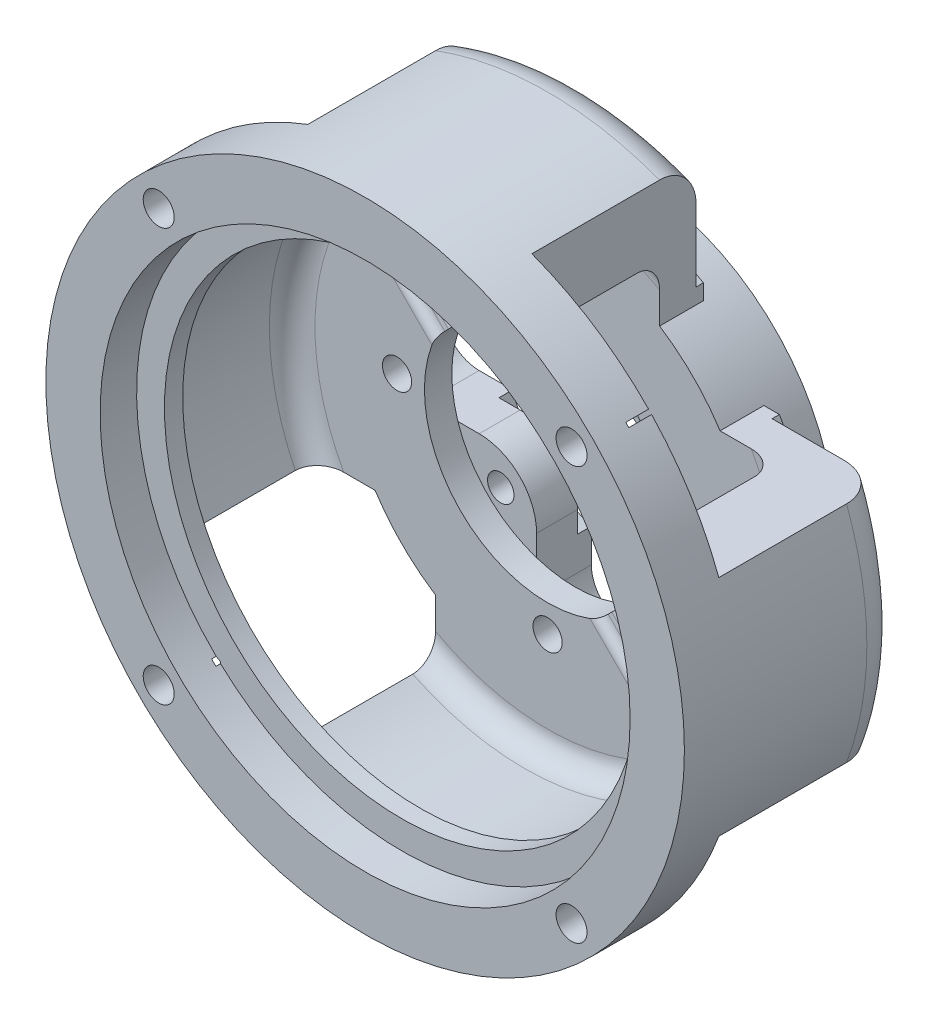
from build123d import *

# Parameters (mm, degrees)
SKETCH_1_W                    = 35
SKETCH_1_H                    = 6
CUT_EXTRUDE_1_DEPTH           = 2.5
HOLE_WIZARD_M48_1_D           = 52
HOLE_WIZARD_M48_1_CBORE_D     = 58.1
HOLE_WIZARD_M48_1_CBORE_DEPTH = 4
CUT_EXTRUDE_2_DEPTH           = 50.859803449
CUT_EXTRUDE_2_DEPTH_BACK      = 50.859803449
SKETCH_17_R                   = 1.7
EXTRUDE_START                 = 23
SKETCH_18_R                   = 35
EXTRUDE_1_DEPTH               = 23
SKETCH_19_R                   = 28
CUT_EXTRUDE_3_DEPTH           = 14
SKETCH_20_R                   = 13.5
CUT_EXTRUDE_5_DEPTH           = 23
CUT_EXTRUDE_6_DEPTH           = 6
SKETCH_22_R                   = 1.6
CUT_EXTRUDE_7_DEPTH           = 3
EXTRUDE_START_2               = 4.5
SKETCH_24_R                   = 1.45
EXTRUDE_2_DEPTH               = 4.5
SKETCH_25_R                   = 35
SKETCH_25_R_2                 = 24
CUT_EXTRUDE_8_DEPTH           = 5
SKETCH_27_R                   = 24
SKETCH_27_R_2                 = 22.55
CUT_EXTRUDE_9_DEPTH           = 4.2
CUT_EXTRUDE_10_DEPTH          = 1.5
FILLET_1_R                    = 4
FILLET_2_R                    = 2.5
CUT_EXTRUDE_11_DEPTH          = 73.526395572
CUT_EXTRUDE_11_DEPTH_BACK     = 73.526395572
SKETCH_31_W                   = 9.376817256
SKETCH_31_H                   = 2.4
FILLET_3_R                    = 1


with BuildPart() as part:
    # 草图1 → 旋转1 (revolve)
    with BuildSketch(Plane(origin=(0, 0, 0), x_dir=(1, 0, 0), z_dir=(0, 1, 0))):
        with Locations((17.5, 27.010169219)):
            Rectangle(SKETCH_1_W, SKETCH_1_H)
    revolve(axis=Axis((0, 0, -30.010169219), (0, 0, 1)))

    # 草图2 → 切除-拉伸1 (cut)
    with BuildSketch(Plane(origin=(0, 0, -30.010169219), x_dir=(-1, 0, 0), z_dir=(0, 0, -1))):
        Polygon((-21.025270001, -19.852416998), (-24.229563995, -19.852416998), (-25.831710992, -22.627416998), (-24.229563995, -25.402416998), (-21.025270001, -25.402416998), (-19.423123004, -22.627416998), align=None)
        Polygon((-22.627416998, 25.831710992), (-25.402416998, 24.229563995), (-25.402416998, 21.025270001), (-22.627416998, 19.423123004), (-19.852416998, 21.025270001), (-19.852416998, 24.229563995), align=None)
        Polygon((25.831710992, 22.627416998), (24.229563995, 25.402416998), (21.025270001, 25.402416998), (19.423123004, 22.627416998), (21.025270001, 19.852416998), (24.229563995, 19.852416998), align=None)
        Polygon((22.627416998, -25.831710992), (25.402416998, -24.229563995), (25.402416998, -21.025270001), (22.627416998, -19.423123004), (19.852416998, -21.025270001), (19.852416998, -24.229563995), align=None)
    extrude(amount=-CUT_EXTRUDE_1_DEPTH, mode=Mode.SUBTRACT)

    # M48 六角头螺栓的柱形沉头孔1 (through all)
    with Locations(Plane.XY.offset(-24.010169219)):
        with Locations((0, 0)):
            CounterBoreHole(HOLE_WIZARD_M48_1_D / 2, HOLE_WIZARD_M48_1_CBORE_D / 2, HOLE_WIZARD_M48_1_CBORE_DEPTH)

    # 草图17 → 切除-拉伸2 (cut, two sides: drawn at the far end of the back side and taken through both)
    with BuildSketch(Plane(origin=(0, 0, -30.010169219), x_dir=(-1, 0, 0), z_dir=(0, 0, -1)).offset(-CUT_EXTRUDE_2_DEPTH_BACK)):
        with Locations((-22.627416998, -22.627416998)):
            Circle(SKETCH_17_R)
        with Locations((-22.627416998, 22.627416998)):
            Circle(SKETCH_17_R)
        with Locations((22.627416998, 22.627416998)):
            Circle(SKETCH_17_R)
        with Locations((22.627416998, -22.627416998)):
            Circle(SKETCH_17_R)
    extrude(amount=CUT_EXTRUDE_2_DEPTH + CUT_EXTRUDE_2_DEPTH_BACK, mode=Mode.SUBTRACT)

    # 草图18 → 凸台-拉伸1 (add)
    with BuildSketch(Plane(origin=(0, 0, -30.010169219), x_dir=(-1, 0, 0), z_dir=(0, 0, -1)).offset(EXTRUDE_START)):
        with Locations(Location((0, 0, 0), (0, 0, 180))):
            Circle(SKETCH_18_R)
    extrude(amount=-EXTRUDE_1_DEPTH)

    # 草图19 → 切除-拉伸3 (cut)
    with BuildSketch(Plane.XY.offset(-30.010169219)):
        Circle(SKETCH_19_R)
    extrude(amount=-CUT_EXTRUDE_3_DEPTH, mode=Mode.SUBTRACT)

    # 草图20 → 切除-拉伸5 (cut)
    with BuildSketch(Plane(origin=(0, 0, -53.010169219), x_dir=(-1, 0, 0), z_dir=(0, 0, -1))):
        with BuildLine():
            ThreePointArc((-12.28161024, -18.912021307), (-15.945257916, -15.945257916), (-18.912021307, -12.28161024))
            Line((-18.912021307, -12.28161024), (-32.774411511, -12.28161024))
            ThreePointArc((-32.774411511, -12.28161024), (-24.748737342, -24.748737342), (-12.28161024, -32.774411511))
            Line((-12.28161024, -32.774411511), (-12.28161024, -18.912021307))
        make_face()
        with BuildLine():
            ThreePointArc((-12.28161024, 32.774411511), (-24.748737342, 24.748737342), (-32.774411511, 12.28161024))
            Line((-32.774411511, 12.28161024), (-18.912021307, 12.28161024))
            ThreePointArc((-18.912021307, 12.28161024), (-15.945257916, 15.945257916), (-12.28161024, 18.912021307))
            Line((-12.28161024, 18.912021307), (-12.28161024, 32.774411511))
        make_face()
        with BuildLine():
            Line((12.28161024, -18.912021307), (12.28161024, -32.774411511))
            ThreePointArc((12.28161024, -32.774411511), (24.748737342, -24.748737342), (32.774411511, -12.28161024))
            Line((32.774411511, -12.28161024), (18.912021307, -12.28161024))
            ThreePointArc((18.912021307, -12.28161024), (15.945257916, -15.945257916), (12.28161024, -18.912021307))
        make_face()
        with BuildLine():
            ThreePointArc((32.774411511, 12.28161024), (24.748737342, 24.748737342), (12.28161024, 32.774411511))
            Line((12.28161024, 32.774411511), (12.28161024, 18.912021307))
            ThreePointArc((12.28161024, 18.912021307), (15.945257916, 15.945257916), (18.912021307, 12.28161024))
            Line((18.912021307, 12.28161024), (32.774411511, 12.28161024))
        make_face()
        Circle(SKETCH_20_R)
    extrude(amount=-CUT_EXTRUDE_5_DEPTH, mode=Mode.SUBTRACT)

    # 草图21 → 切除-拉伸6 (cut)
    with BuildSketch(Plane(origin=(0, 0, -53.010169219), x_dir=(-1, 0, 0), z_dir=(0, 0, -1))):
        with BuildLine():
            Line((-4.2, 16.5), (-4.2, 10.5))
            ThreePointArc((-4.2, 10.5), (-6.045227279, 6.045227279), (-10.5, 4.2))
            Line((-10.5, 4.2), (-16.5, 4.2))
            ThreePointArc((-16.5, 4.2), (-19.328427125, 3.028427125), (-20.5, 0.2))
            Line((-20.5, 0.2), (-20.5, -0.2))
            ThreePointArc((-20.5, -0.2), (-19.328427125, -3.028427125), (-16.5, -4.2))
            Line((-16.5, -4.2), (-10.5, -4.2))
            ThreePointArc((-10.5, -4.2), (-6.045227279, -6.045227279), (-4.2, -10.5))
            Line((-4.2, -10.5), (-4.2, -16.5))
            ThreePointArc((-4.2, -16.5), (-3.028427125, -19.328427125), (-0.2, -20.5))
            Line((-0.2, -20.5), (0.2, -20.5))
            ThreePointArc((0.2, -20.5), (3.028427125, -19.328427125), (4.2, -16.5))
            Line((4.2, -16.5), (4.2, -10.5))
            ThreePointArc((4.2, -10.5), (6.045227279, -6.045227279), (10.5, -4.2))
            Line((10.5, -4.2), (16.5, -4.2))
            ThreePointArc((16.5, -4.2), (19.328427125, -3.028427125), (20.5, -0.2))
            Line((20.5, -0.2), (20.5, 0.2))
            ThreePointArc((20.5, 0.2), (19.328427125, 3.028427125), (16.5, 4.2))
            Line((16.5, 4.2), (10.5, 4.2))
            ThreePointArc((10.5, 4.2), (6.045227279, 6.045227279), (4.2, 10.5))
            Line((4.2, 10.5), (4.2, 16.5))
            ThreePointArc((4.2, 16.5), (3.028427125, 19.328427125), (0.2, 20.5))
            Line((0.2, 20.5), (-0.2, 20.5))
            ThreePointArc((-0.2, 20.5), (-3.028427125, 19.328427125), (-4.2, 16.5))
        make_face()
    extrude(amount=-CUT_EXTRUDE_6_DEPTH, mode=Mode.SUBTRACT)

    # 草图22 → 切除-拉伸7 (cut)
    with BuildSketch(Plane(origin=(0, 0, -47.010169219), x_dir=(-1, 0, 0), z_dir=(0, 0, -1))):
        with Locations((-16.5, 0)):
            Circle(SKETCH_22_R)
        with Locations((0, 16.5)):
            Circle(SKETCH_22_R)
        with Locations((16.5, 0)):
            Circle(SKETCH_22_R)
        with Locations((0, -16.5)):
            Circle(SKETCH_22_R)
    extrude(amount=-CUT_EXTRUDE_7_DEPTH, mode=Mode.SUBTRACT)

    # 草图24 → 凸台-拉伸2 (add)
    # profile 1 of 4: a face of its own
    with BuildSketch(Plane(origin=(0, 0, -47.010169219), x_dir=(-1, 0, 0), z_dir=(0, 0, -1)).offset(EXTRUDE_START_2)):
        with BuildLine():
            Line((-10.5, -4.2), (-12.830042868, -4.2))
            ThreePointArc((-12.830042868, -4.2), (-9.545941546, -9.545941546), (-4.2, -12.830042868))
            Line((-4.2, -12.830042868), (-4.2, -10.5))
            ThreePointArc((-4.2, -10.5), (-6.045227279, -6.045227279), (-10.5, -4.2))
        make_face()
        with Locations((-8.131727984, -8.131727984)):
            Circle(SKETCH_24_R, mode=Mode.SUBTRACT)
    # profile 2 of 4: a face of its own
    with BuildSketch(Plane(origin=(0, 0, -47.010169219), x_dir=(-1, 0, 0), z_dir=(0, 0, -1)).offset(EXTRUDE_START_2)):
        with BuildLine():
            ThreePointArc((-4.2, 12.830042868), (-9.545941546, 9.545941546), (-12.830042868, 4.2))
            Line((-12.830042868, 4.2), (-10.5, 4.2))
            ThreePointArc((-10.5, 4.2), (-6.045227279, 6.045227279), (-4.2, 10.5))
            Line((-4.2, 10.5), (-4.2, 12.830042868))
        make_face()
        with Locations((-8.131727984, 8.131727984)):
            Circle(SKETCH_24_R, mode=Mode.SUBTRACT)
    # profile 3 of 4: a face of its own
    with BuildSketch(Plane(origin=(0, 0, -47.010169219), x_dir=(-1, 0, 0), z_dir=(0, 0, -1)).offset(EXTRUDE_START_2)):
        with BuildLine():
            Line((4.2, -10.5), (4.2, -12.830042868))
            ThreePointArc((4.2, -12.830042868), (9.545941546, -9.545941546), (12.830042868, -4.2))
            Line((12.830042868, -4.2), (10.5, -4.2))
            ThreePointArc((10.5, -4.2), (6.045227279, -6.045227279), (4.2, -10.5))
        make_face()
        with Locations((8.131727984, -8.131727984)):
            Circle(SKETCH_24_R, mode=Mode.SUBTRACT)
    # profile 4 of 4: a face of its own
    with BuildSketch(Plane(origin=(0, 0, -47.010169219), x_dir=(-1, 0, 0), z_dir=(0, 0, -1)).offset(EXTRUDE_START_2)):
        with BuildLine():
            ThreePointArc((12.830042868, 4.2), (9.545941546, 9.545941546), (4.2, 12.830042868))
            Line((4.2, 12.830042868), (4.2, 10.5))
            ThreePointArc((4.2, 10.5), (6.045227279, 6.045227279), (10.5, 4.2))
            Line((10.5, 4.2), (12.830042868, 4.2))
        make_face()
        with Locations((8.131727984, 8.131727984)):
            Circle(SKETCH_24_R, mode=Mode.SUBTRACT)
    extrude(amount=-EXTRUDE_2_DEPTH)

    # 草图25 → 切除-拉伸8 (cut)
    with BuildSketch(Plane(origin=(0, 0, -53.010169219), x_dir=(-1, 0, 0), z_dir=(0, 0, -1))):
        with Locations(Location((0, 0, 0), (0, 0, 180))):
            Circle(SKETCH_25_R)
        Circle(SKETCH_25_R_2, mode=Mode.SUBTRACT)
    extrude(amount=-CUT_EXTRUDE_8_DEPTH, mode=Mode.SUBTRACT)

    # 草图27 → 切除-拉伸9 (cut)
    with BuildSketch(Plane(origin=(0, 0, -53.010169219), x_dir=(-1, 0, 0), z_dir=(0, 0, -1))):
        Circle(SKETCH_27_R)
        Circle(SKETCH_27_R_2, mode=Mode.SUBTRACT)
    extrude(amount=-CUT_EXTRUDE_9_DEPTH, mode=Mode.SUBTRACT)

    # 草图29 → 切除-拉伸10 (cut)
    with BuildSketch(Plane(origin=(0, 0, -53.010169219), x_dir=(-1, 0, 0), z_dir=(0, 0, -1))):
        with BuildLine():
            Line((-9.5, 11.5), (9.5, 11.5))
            ThreePointArc((9.5, 11.5), (10.914213562, 10.914213562), (11.5, 9.5))
            Line((11.5, 9.5), (11.5, -9.5))
            ThreePointArc((11.5, -9.5), (10.914213562, -10.914213562), (9.5, -11.5))
            Line((9.5, -11.5), (-9.5, -11.5))
            ThreePointArc((-9.5, -11.5), (-10.914213562, -10.914213562), (-11.5, -9.5))
            Line((-11.5, -9.5), (-11.5, 9.5))
            ThreePointArc((-11.5, 9.5), (-10.914213562, 10.914213562), (-9.5, 11.5))
        make_face()
    extrude(amount=-CUT_EXTRUDE_10_DEPTH, mode=Mode.SUBTRACT)

    # 圆角1
    fillet_1_edges = [part.edges().sort_by_distance(p)[0] for p in [
        (34.439108604, 6.240817138, -48.010169219),
        (0, 35, -48.010169219),
        (-35, 0, -48.010169219),
        (0, -35, -48.010169219),
    ]]
    fillet(fillet_1_edges, radius=FILLET_1_R)

    # 圆角2
    fillet_2_edges = [part.edges().sort_by_distance(p)[0] for p in [
        (0, 28, -44.010169219),
        (-28, 0, -44.010169219),
        (0, -28, -44.010169219),
        (28, 0, -44.010169219),
    ]]
    fillet(fillet_2_edges, radius=FILLET_2_R)

    # 草图31 → 切除-拉伸11 (cut, two sides: drawn at the far end of the back side and taken through both)
    with BuildSketch(Plane(origin=(0, 0, 0), x_dir=(-0.7071067811865476, -0.7071067811865476, 0), z_dir=(0.7071067811865476, -0.7071067811865476, 0)).offset(-CUT_EXTRUDE_11_DEPTH_BACK)):
        with Locations((0, 45.210169219)):
            Rectangle(SKETCH_31_W, SKETCH_31_H)
    extrude(amount=CUT_EXTRUDE_11_DEPTH + CUT_EXTRUDE_11_DEPTH_BACK, mode=Mode.SUBTRACT)

    # 圆角3
    # the kernel refuses this fillet: 1 mm, written as the material it adds along each edge
    with BuildSketch(Plane(origin=(20.67978826, -14.049377193, -46.410169219), x_dir=(-0.7071067811865476, -0.7071067811865476, 0), z_dir=(-0.7071067811865476, 0.7071067811865476, 0))) as fillet_3_piece_1_section:
        with BuildLine():
            CenterArc((FILLET_3_R, FILLET_3_R), FILLET_3_R, 180, 90)
            Line((0, FILLET_3_R), (0, 0))
            Line((0, 0), (FILLET_3_R, 0))
        make_face()
    fillet_3_piece_1 = extrude(amount=14.397495993, mode=Mode.PRIVATE)
    fillet_3_piece_1 = fillet_3_piece_1 & Plane(origin=(0, 0, -46.303313987), x_dir=(0.5446390350150296, -0.8386705679454224, 0), z_dir=(0, 0, -1)) * Cylinder(22.55, 33, mode=Mode.PRIVATE)
    fillet_3_piece_1 = split(fillet_3_piece_1, bisect_by=Plane(origin=(18.48720103, -12.28161024, -46.303313987), z_dir=(0, -1, 0)), keep=Keep.TOP, mode=Mode.PRIVATE)
    add(fillet_3_piece_1)
    with BuildSketch(Plane(origin=(20.67978826, -14.049377193, -46.410169219), x_dir=(-0.7071067811865476, -0.7071067811865476, 0), z_dir=(-0.7071067811865476, 0.7071067811865476, 0))) as fillet_3_piece_2_section:
        with BuildLine():
            CenterArc((FILLET_3_R, FILLET_3_R), FILLET_3_R, 180, 90)
            Line((0, FILLET_3_R), (0, 0))
            Line((0, 0), (FILLET_3_R, 0))
        make_face()
    fillet_3_piece_2 = extrude(amount=14.397495993, mode=Mode.PRIVATE)
    fillet_3_piece_2 = fillet_3_piece_2 & Plane(origin=(0, 0, -46.179741801), x_dir=(0.5446390350150296, -0.8386705679454224, 0), z_dir=(0, 0, -1)) * Cylinder(22.55, 33, mode=Mode.PRIVATE)
    fillet_3_piece_2 = split(fillet_3_piece_2, bisect_by=Plane(origin=(15.38355487, -12.28161024, -46.179741801), z_dir=(0, 1, 0)), keep=Keep.TOP, mode=Mode.PRIVATE)
    fillet_3_piece_2 = fillet_3_piece_2 - Plane(origin=(0, 0, -46.179741801), x_dir=(-1, 0, 0), z_dir=(0, 0, -1)) * Cylinder(13.5, 33, mode=Mode.PRIVATE)
    add(fillet_3_piece_2)
    with BuildSketch(Plane(origin=(-3.868810144, 10.499221212, -46.410169219), x_dir=(0, 0, 1), z_dir=(-0.7071067811865476, 0.7071067811865476, 0))) as fillet_3_piece_3_section:
        with BuildLine():
            CenterArc((FILLET_3_R, -FILLET_3_R), FILLET_3_R, 90, 90)
            Line((0, -FILLET_3_R), (0, 0))
            Line((0, 0), (FILLET_3_R, 0))
        make_face()
    fillet_3_piece_3 = extrude(amount=14.397495993, mode=Mode.PRIVATE)
    fillet_3_piece_3 = split(fillet_3_piece_3, bisect_by=Plane(origin=(-12.28161024, 15.383571152, -46.179742656), z_dir=(1, 0, 0)), keep=Keep.TOP, mode=Mode.PRIVATE)
    fillet_3_piece_3 = fillet_3_piece_3 - Plane(origin=(0, 0, -46.179742656), x_dir=(-1, 0, 0), z_dir=(0, 0, -1)) * Cylinder(13.5, 33, mode=Mode.PRIVATE)
    fillet_3_piece_3 = fillet_3_piece_3 & Plane(origin=(0, 0, -46.179742656), x_dir=(-0.54463903501503, 0.8386705679454223, 0), z_dir=(0, 0, -1)) * Cylinder(22.55, 33, mode=Mode.PRIVATE)
    add(fillet_3_piece_3)
    with BuildSketch(Plane(origin=(-3.868810144, 10.499221212, -46.410169219), x_dir=(0, 0, 1), z_dir=(-0.7071067811865476, 0.7071067811865476, 0))) as fillet_3_piece_4_section:
        with BuildLine():
            CenterArc((FILLET_3_R, -FILLET_3_R), FILLET_3_R, 90, 90)
            Line((0, -FILLET_3_R), (0, 0))
            Line((0, 0), (FILLET_3_R, 0))
        make_face()
    fillet_3_piece_4 = extrude(amount=14.397495993, mode=Mode.PRIVATE)
    fillet_3_piece_4 = split(fillet_3_piece_4, bisect_by=Plane(origin=(-12.28161024, 18.487198774, -46.303316227), z_dir=(-1, 0, 0)), keep=Keep.TOP, mode=Mode.PRIVATE)
    fillet_3_piece_4 = fillet_3_piece_4 & Plane(origin=(0, 0, -46.303316227), x_dir=(-0.54463903501503, 0.8386705679454223, 0), z_dir=(0, 0, -1)) * Cylinder(22.55, 33, mode=Mode.PRIVATE)
    add(fillet_3_piece_4)
    with BuildSketch(Plane(origin=(-20.67978826, 14.049377193, -46.410169219), x_dir=(0, 0, 1), z_dir=(0.7071067811865476, -0.7071067811865476, 0))) as fillet_3_piece_5_section:
        with BuildLine():
            CenterArc((FILLET_3_R, -FILLET_3_R), FILLET_3_R, 90, 90)
            Line((0, -FILLET_3_R), (0, 0))
            Line((0, 0), (FILLET_3_R, 0))
        make_face()
    fillet_3_piece_5 = extrude(amount=14.397495993, mode=Mode.PRIVATE)
    fillet_3_piece_5 = split(fillet_3_piece_5, bisect_by=Plane(origin=(-18.487199612, 12.28161024, -46.303314827), z_dir=(0, 1, 0)), keep=Keep.TOP, mode=Mode.PRIVATE)
    fillet_3_piece_5 = fillet_3_piece_5 & Plane(origin=(0, 0, -46.303314827), x_dir=(-0.54463903501503, 0.8386705679454223, 0), z_dir=(0, 0, -1)) * Cylinder(22.55, 33, mode=Mode.PRIVATE)
    add(fillet_3_piece_5)
    with BuildSketch(Plane(origin=(-20.67978826, 14.049377193, -46.410169219), x_dir=(0, 0, 1), z_dir=(0.7071067811865476, -0.7071067811865476, 0))) as fillet_3_piece_6_section:
        with BuildLine():
            CenterArc((FILLET_3_R, -FILLET_3_R), FILLET_3_R, 90, 90)
            Line((0, -FILLET_3_R), (0, 0))
            Line((0, 0), (FILLET_3_R, 0))
        make_face()
    fillet_3_piece_6 = extrude(amount=14.397495993, mode=Mode.PRIVATE)
    fillet_3_piece_6 = split(fillet_3_piece_6, bisect_by=Plane(origin=(-15.383555685, 12.28161024, -46.179741819), z_dir=(0, -1, 0)), keep=Keep.TOP, mode=Mode.PRIVATE)
    fillet_3_piece_6 = fillet_3_piece_6 - Plane(origin=(0, 0, -46.179741819), x_dir=(-1, 0, 0), z_dir=(0, 0, -1)) * Cylinder(13.5, 33, mode=Mode.PRIVATE)
    fillet_3_piece_6 = fillet_3_piece_6 & Plane(origin=(0, 0, -46.179741819), x_dir=(-0.54463903501503, 0.8386705679454223, 0), z_dir=(0, 0, -1)) * Cylinder(22.55, 33, mode=Mode.PRIVATE)
    add(fillet_3_piece_6)
    with BuildSketch(Plane(origin=(3.868810144, -10.499221212, -46.410169219), x_dir=(0, 0, 1), z_dir=(0.7071067811865476, -0.7071067811865476, 0))) as fillet_3_piece_7_section:
        with BuildLine():
            CenterArc((FILLET_3_R, -FILLET_3_R), FILLET_3_R, 90, 90)
            Line((0, -FILLET_3_R), (0, 0))
            Line((0, 0), (FILLET_3_R, 0))
        make_face()
    fillet_3_piece_7 = extrude(amount=14.397495993, mode=Mode.PRIVATE)
    fillet_3_piece_7 = split(fillet_3_piece_7, bisect_by=Plane(origin=(12.28161024, -15.383553083, -46.17974176), z_dir=(-1, 0, 0)), keep=Keep.TOP, mode=Mode.PRIVATE)
    fillet_3_piece_7 = fillet_3_piece_7 & Plane(origin=(0, 0, -46.17974176), x_dir=(0.5446390350150296, -0.8386705679454224, 0), z_dir=(0, 0, -1)) * Cylinder(22.55, 33, mode=Mode.PRIVATE)
    fillet_3_piece_7 = fillet_3_piece_7 - Plane(origin=(0, 0, -46.17974176), x_dir=(-1, 0, 0), z_dir=(0, 0, -1)) * Cylinder(13.5, 33, mode=Mode.PRIVATE)
    add(fillet_3_piece_7)
    with BuildSketch(Plane(origin=(3.868810144, -10.499221212, -46.410169219), x_dir=(0, 0, 1), z_dir=(0.7071067811865476, -0.7071067811865476, 0))) as fillet_3_piece_8_section:
        with BuildLine():
            CenterArc((FILLET_3_R, -FILLET_3_R), FILLET_3_R, 90, 90)
            Line((0, -FILLET_3_R), (0, 0))
            Line((0, 0), (FILLET_3_R, 0))
        make_face()
    fillet_3_piece_8 = extrude(amount=14.397495993, mode=Mode.PRIVATE)
    fillet_3_piece_8 = split(fillet_3_piece_8, bisect_by=Plane(origin=(12.28161024, -18.487198774, -46.303316227), z_dir=(1, 0, 0)), keep=Keep.TOP, mode=Mode.PRIVATE)
    fillet_3_piece_8 = fillet_3_piece_8 & Plane(origin=(0, 0, -46.303316227), x_dir=(0.5446390350150296, -0.8386705679454224, 0), z_dir=(0, 0, -1)) * Cylinder(22.55, 33, mode=Mode.PRIVATE)
    add(fillet_3_piece_8)
    # the kernel refuses this fillet: 1 mm, written as the material it takes off along each edge
    with BuildSketch(Plane(origin=(20.67978826, -14.049377193, -44.010169219), x_dir=(0.7071067811865476, 0.7071067811865476, 0), z_dir=(-0.7071067811865476, 0.7071067811865476, 0)), Plane(origin=(-3.868810144, 10.499221212, -44.010169219), x_dir=(0.7071067811865476, 0.7071067811865476, 0), z_dir=(-0.7071067811865476, 0.7071067811865476, 0)), Plane(origin=(3.868810144, -10.499221212, -44.010169219), x_dir=(-0.7071067811865476, -0.7071067811865476, 0), z_dir=(0.7071067811865476, -0.7071067811865476, 0)), Plane(origin=(-20.67978826, 14.049377193, -44.010169219), x_dir=(-0.7071067811865476, -0.7071067811865476, 0), z_dir=(0.7071067811865476, -0.7071067811865476, 0))) as fillet_3_2_piece_1:
        with BuildLine():
            CenterArc((FILLET_3_R, FILLET_3_R), FILLET_3_R, 180, 90)
            Line((0, FILLET_3_R), (0, 0))
            Line((0, 0), (FILLET_3_R, 0))
        make_face()
    extrude(amount=14.397495993, mode=Mode.SUBTRACT)


solid = part.part
